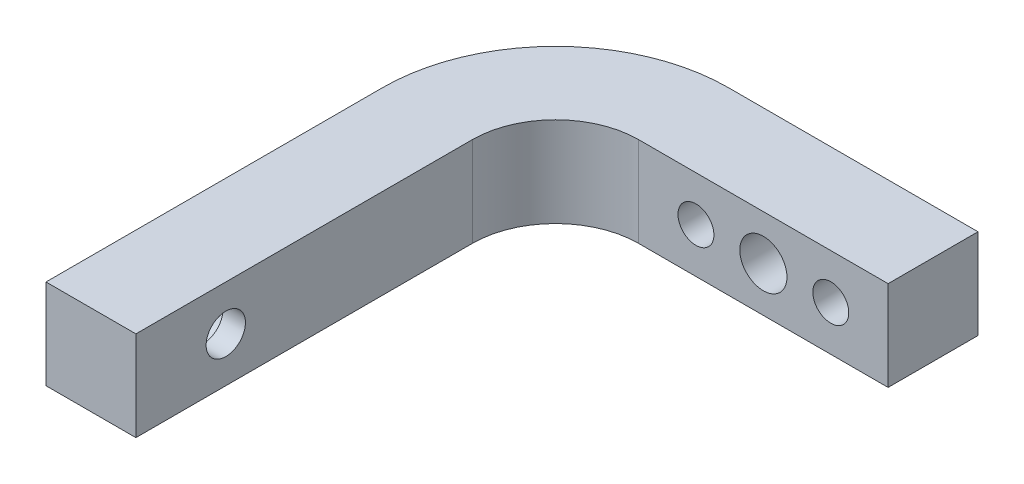
from build123d import *

# Parameters (mm, degrees)
BOSS_EXTRUDE1_DEPTH      = 4
BOSS_EXTRUDE1_DEPTH_BACK = 4
CUT_EXTRUDE1_DEPTH       = 55.294342247
CUT_EXTRUDE1_DEPTH_BACK  = 55.294342247
SKETCH2_R                = 1.75
SKETCH3_R                = 2.1
SKETCH3_R_2              = 1.6
CUT_EXTRUDE2_DEPTH       = 53.668449759
SKETCH4_R                = 2.25
CUT_EXTRUDE3_DEPTH       = 6
SKETCH5_R                = 3.75
CUT_EXTRUDE4_DEPTH       = 0.75


with BuildPart() as part:
    # Sketch1 → Boss-Extrude1 (new, two sides: drawn at the far end of the back side and taken through both)
    with BuildSketch(Plane(origin=(0, 0, 0), x_dir=(1, 0, 0), z_dir=(0, 1, 0)).offset(-BOSS_EXTRUDE1_DEPTH_BACK)):
        with BuildLine():
            Line((-11.1, 0), (11.1, 0))
            Line((11.1, 0), (11.1, -8))
            Line((11.1, -8), (-11.1, -8))
            ThreePointArc((-11.1, -8), (-16.332590181, -10.167409819), (-18.5, -15.4))
            Line((-18.5, -15.4), (-18.5, -45.34))
            Line((-18.5, -45.34), (-26.5, -45.34))
            Line((-26.5, -45.34), (-26.5, -15.4))
            ThreePointArc((-26.5, -15.4), (-21.98944443, -4.51055557), (-11.1, 0))
        make_face()
    extrude(amount=BOSS_EXTRUDE1_DEPTH + BOSS_EXTRUDE1_DEPTH_BACK)

    # Sketch2 → Cut-Extrude1 (cut, two sides: drawn at the far end of the back side and taken through both)
    with BuildSketch(Plane.ZY.offset(18.5).offset(-CUT_EXTRUDE1_DEPTH_BACK)):
        with Locations((37.34, 0)):
            Circle(SKETCH2_R)
    extrude(amount=CUT_EXTRUDE1_DEPTH + CUT_EXTRUDE1_DEPTH_BACK, mode=Mode.SUBTRACT)

    # Sketch3 → Cut-Extrude2 (cut, through all)
    with BuildSketch(Plane(origin=(0, 0, 0), x_dir=(-1, 0, 0), z_dir=(0, 0, -1))):
        Circle(SKETCH3_R)
        with Locations((-6, 0)):
            Circle(SKETCH3_R_2)
        with Locations((6, 0)):
            Circle(SKETCH3_R_2)
    extrude(amount=-CUT_EXTRUDE2_DEPTH, mode=Mode.SUBTRACT)

    # Sketch4 → Cut-Extrude3 (cut)
    with BuildSketch(Plane(origin=(-26.5, 0, 0), x_dir=(0, 0, -1), z_dir=(1, 0, 0))):
        with Locations((-37.34, 0)):
            Circle(SKETCH4_R)
    extrude(amount=CUT_EXTRUDE3_DEPTH, mode=Mode.SUBTRACT)

    # Sketch5 → Cut-Extrude4 (cut)
    with BuildSketch(Plane.ZY.offset(26.5)):
        with Locations((37.34, 0)):
            Circle(SKETCH5_R)
    extrude(amount=-CUT_EXTRUDE4_DEPTH, mode=Mode.SUBTRACT)


solid = part.part
